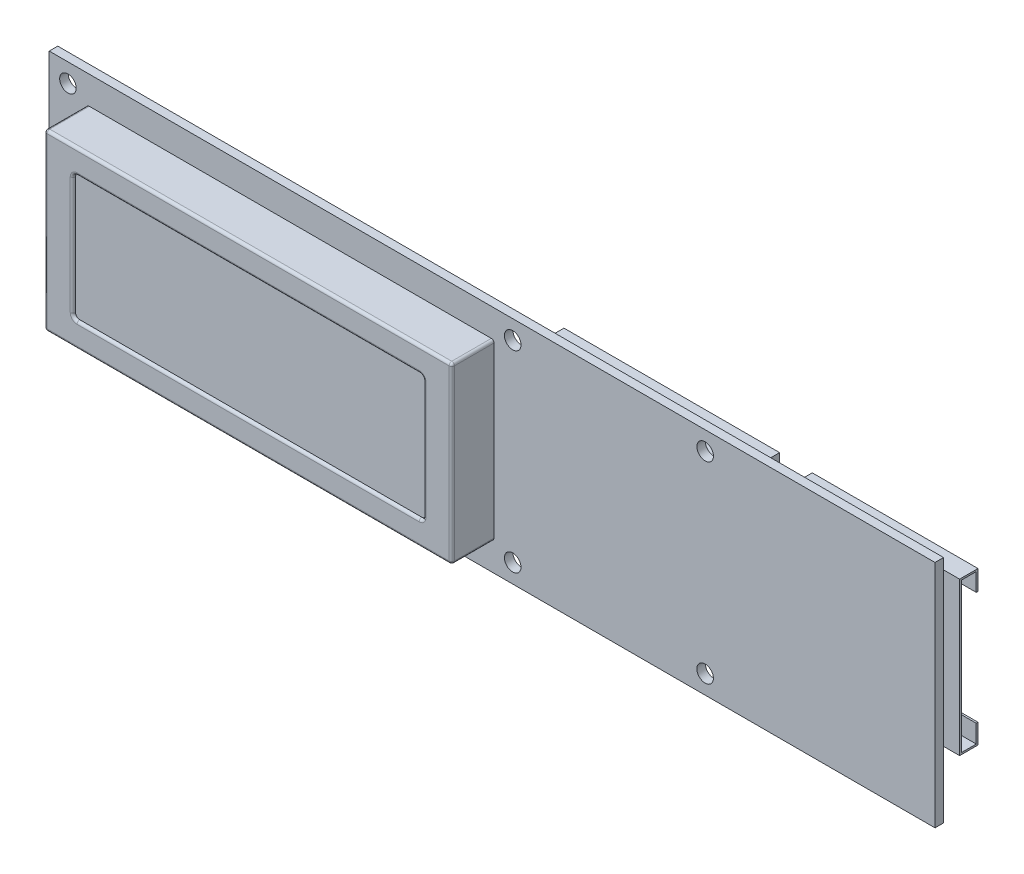
from build123d import *

# Parameters (mm, degrees)
SKETCH1_R                  = 1.55
BOSS_EXTRUDE1_DEPTH        = 1.6
SKETCH3_W                  = 76.2
SKETCH3_H                  = 32.6
BOSS_EXTRUDE3_DEPTH        = 7.9
CUT_EXTRUDE1_DEPTH         = 0.5
FILLET1_R                  = 0.5
SKETCH5_W                  = 31
SKETCH5_H                  = 28.6
BOSS_EXTRUDE4_DEPTH        = 3.44
SKETCH6_W                  = 2.78
SKETCH6_H                  = 27.94
CUT_EXTRUDE2_DEPTH         = 30.5
CUT_EXTRUDE3_DEPTH         = 0.33
SKETCH8_W                  = 40.34
SKETCH8_H                  = 9
BOSS_EXTRUDE5_DEPTH        = 10.16
CUT_EXTRUDE4_DEPTH         = 7.34
SKETCH10_W                 = 0.65
SKETCH10_H                 = 0.65
BOSS_EXTRUDE6_DEPTH        = 7.34
LPATTERN2_COUNT            = 8
LPATTERN2_PITCH            = 2.54
LPATTERN2_COL_COUNT        = 6
LPATTERN2_COL_PITCH        = 2.54
LPATTERN3_COUNT            = 2
LPATTERN3_PITCH            = 2.54
LPATTERN3_COPY_1_SKETCH_W  = 0.65
LPATTERN3_COPY_1_SKETCH_H  = 0.65
LPATTERN3_COPY_1_DEPTH     = 7.34
LPATTERN3_COPY_2_SKETCH_W  = 0.65
LPATTERN3_COPY_2_SKETCH_H  = 0.65
LPATTERN3_COPY_2_DEPTH     = 7.34
LPATTERN3_COPY_3_SKETCH_W  = 0.65
LPATTERN3_COPY_3_SKETCH_H  = 0.65
LPATTERN3_COPY_3_DEPTH     = 7.34
LPATTERN3_COPY_4_SKETCH_W  = 0.65
LPATTERN3_COPY_4_SKETCH_H  = 0.65
LPATTERN3_COPY_4_DEPTH     = 7.34
LPATTERN3_COPY_5_SKETCH_W  = 0.65
LPATTERN3_COPY_5_SKETCH_H  = 0.65
LPATTERN3_COPY_5_DEPTH     = 7.34
LPATTERN3_COPY_6_SKETCH_W  = 0.65
LPATTERN3_COPY_6_SKETCH_H  = 0.65
LPATTERN3_COPY_6_DEPTH     = 7.34
LPATTERN3_COPY_7_SKETCH_W  = 0.65
LPATTERN3_COPY_7_SKETCH_H  = 0.65
LPATTERN3_COPY_7_DEPTH     = 7.34
LPATTERN3_COPY_8_SKETCH_W  = 0.65
LPATTERN3_COPY_8_SKETCH_H  = 0.65
LPATTERN3_COPY_8_DEPTH     = 7.34
LPATTERN3_COPY_9_SKETCH_W  = 0.65
LPATTERN3_COPY_9_SKETCH_H  = 0.65
LPATTERN3_COPY_9_DEPTH     = 7.34
LPATTERN3_COPY_10_SKETCH_W = 0.65
LPATTERN3_COPY_10_SKETCH_H = 0.65
LPATTERN3_COPY_10_DEPTH    = 7.34
LPATTERN3_COPY_11_SKETCH_W = 0.65
LPATTERN3_COPY_11_SKETCH_H = 0.65
LPATTERN3_COPY_11_DEPTH    = 7.34
LPATTERN3_COPY_12_SKETCH_W = 0.65
LPATTERN3_COPY_12_SKETCH_H = 0.65
LPATTERN3_COPY_12_DEPTH    = 7.34
CHAMFER1_SIZE              = 0.25
SKETCH14_W                 = 0.65
SKETCH14_H                 = 5.025
BOSS_EXTRUDE8_DEPTH        = 0.62


with BuildPart() as part:
    # Sketch1 → Boss-Extrude1 (new body)
    with BuildSketch(Plane.XY):
        Polygon((0, 43), (126.2, 43), (165.7, 43), (165.7, 0), (126.2, 0), (0, 0), align=None)
        with Locations((3.5, 39.5)):
            Circle(SKETCH1_R, mode=Mode.SUBTRACT)
        with Locations((122.7, 39.5)):
            Circle(SKETCH1_R, mode=Mode.SUBTRACT)
        with Locations((122.7, 3.5)):
            Circle(SKETCH1_R, mode=Mode.SUBTRACT)
        with Locations((3.5, 3.5)):
            Circle(SKETCH1_R, mode=Mode.SUBTRACT)
        with Locations((86.7, 39.5)):
            Circle(SKETCH1_R, mode=Mode.SUBTRACT)
        with Locations((86.7, 3.5)):
            Circle(SKETCH1_R, mode=Mode.SUBTRACT)
    extrude(amount=BOSS_EXTRUDE1_DEPTH)

    # Sketch3 → Boss-Extrude3 (add)
    with BuildSketch(Plane.XY.offset(1.6)):
        with Locations((45.1, 21.5)):
            Rectangle(SKETCH3_W, SKETCH3_H)
    extrude(amount=BOSS_EXTRUDE3_DEPTH)

    # Sketch4 → Cut-Extrude1 (cut)
    with BuildSketch(Plane.XY.offset(9.5)):
        with BuildLine():
            Line((13.1, 33.271220178), (77.1, 33.271220178))
            ThreePointArc((77.1, 33.271220178), (77.645335018, 33.045335018), (77.871220178, 32.5))
            Line((77.871220178, 32.5), (77.871220178, 10.5))
            ThreePointArc((77.871220178, 10.5), (77.645335018, 9.954664982), (77.1, 9.728779822))
            Line((77.1, 9.728779822), (13.1, 9.728779822))
            ThreePointArc((13.1, 9.728779822), (12.554664982, 9.954664982), (12.328779822, 10.5))
            Line((12.328779822, 10.5), (12.328779822, 32.5))
            ThreePointArc((12.328779822, 32.5), (12.554664982, 33.045335018), (13.1, 33.271220178))
        make_face()
    extrude(amount=-CUT_EXTRUDE1_DEPTH, mode=Mode.SUBTRACT)

    # Fillet1
    fillet1_edges = [part.edges().sort_by_distance(p)[0] for p in [
        (45.1, 37.8, 9.5),
        (83.2, 21.5, 9.5),
        (45.1, 5.2, 9.5),
        (7, 21.5, 9.5),
        (45.1, 33.271220178, 9.5),
        (12.554664982, 33.045335018, 9.5),
        (12.328779822, 21.5, 9.5),
        (12.554664982, 9.954664982, 9.5),
        (45.1, 9.728779822, 9.5),
        (77.645335018, 9.954664982, 9.5),
        (77.871220178, 21.5, 9.5),
        (77.645335018, 33.045335018, 9.5),
        (7, 5.2, 5.55),
        (83.2, 5.2, 5.55),
        (83.2, 37.8, 5.55),
        (7, 37.8, 5.55),
    ]]
    fillet(fillet1_edges, radius=FILLET1_R - 0.0001)  # a hair under: the kernel refuses the full size

    # Sketch5 → Boss-Extrude4 (add)
    with BuildSketch(Plane(origin=(0, 0, 0), x_dir=(-1, 0, 0), z_dir=(0, 0, -1))):
        with Locations((-153.2, 26.7)):
            Rectangle(SKETCH5_W, SKETCH5_H)
    extrude(amount=BOSS_EXTRUDE4_DEPTH)

    # Sketch6 → Cut-Extrude2 (cut)
    with BuildSketch(Plane(origin=(168.7, 0, 0), x_dir=(0, 0, -1), z_dir=(1, 0, 0))):
        with Locations((1.72, 26.7)):
            Rectangle(SKETCH6_W, SKETCH6_H)
    extrude(amount=-CUT_EXTRUDE2_DEPTH, mode=Mode.SUBTRACT)

    # Sketch7 → Cut-Extrude3 (cut)
    with BuildSketch(Plane(origin=(0, 0, -3.44), x_dir=(-1, 0, 0), z_dir=(0, 0, -1))):
        with BuildLine():
            Line((-168.7, 37.3), (-153.685513052, 37.3))
            ThreePointArc((-153.685513052, 37.3), (-151, 26.7), (-153.685513052, 16.1))
            Line((-153.685513052, 16.1), (-168.7, 16.1))
            Line((-168.7, 16.1), (-168.7, 37.3))
        make_face()
    extrude(amount=-CUT_EXTRUDE3_DEPTH, mode=Mode.SUBTRACT)

    # Sketch8 → Boss-Extrude5 (add)
    with BuildSketch(Plane(origin=(0, 0, 0), x_dir=(-1, 0, 0), z_dir=(0, 0, -1))):
        with Locations((-104.7, 30)):
            Rectangle(SKETCH8_W, SKETCH8_H)
    extrude(amount=BOSS_EXTRUDE5_DEPTH)

    # Sketch9 → Cut-Extrude4 (cut)
    with BuildSketch(Plane(origin=(0, 0, -10.16), x_dir=(-1, 0, 0), z_dir=(0, 0, -1))):
        Polygon((-106.95, 26.5), (-106.95, 25.5), (-102.45, 25.5), (-102.45, 26.5), (-85.53, 26.5), (-85.53, 33.5), (-123.87, 33.5), (-123.87, 26.5), align=None)
    extrude(amount=-CUT_EXTRUDE4_DEPTH, mode=Mode.SUBTRACT)

    # Sketch10 → Boss-Extrude6 (add)
    with BuildSketch(Plane(origin=(0, 0, -2.82), x_dir=(-1, 0, 0), z_dir=(0, 0, -1))):
        with Locations((-107.24, 31.27)):
            Rectangle(SKETCH10_W, SKETCH10_H)
    boss_extrude6 = extrude(amount=BOSS_EXTRUDE6_DEPTH)

    # LPattern2: Boss-Extrude6 ×8
    with Locations(*[(-i * LPATTERN2_PITCH, 0, 0) for i in range(1, LPATTERN2_COUNT)]):
        add(boss_extrude6)

    # LPattern2 col: Boss-Extrude6 ×6
    with Locations(*[(i * LPATTERN2_COL_PITCH, 0, 0) for i in range(1, LPATTERN2_COL_COUNT)]):
        add(boss_extrude6)

    # LPattern3: Boss-Extrude6 ×2
    with Locations(*[(0, -i * LPATTERN3_PITCH, 0) for i in range(1, LPATTERN3_COUNT)]):
        add(boss_extrude6)

    # LPattern3 copy 1 sketch → LPattern3 copy 1 (add)
    with BuildSketch(Plane(origin=(-2.54, -2.54, -2.82), x_dir=(-1, 0, 0), z_dir=(0, 0, -1))):
        with Locations((-107.24, 31.27)):
            Rectangle(LPATTERN3_COPY_1_SKETCH_W, LPATTERN3_COPY_1_SKETCH_H)
    extrude(amount=LPATTERN3_COPY_1_DEPTH)

    # LPattern3 copy 2 sketch → LPattern3 copy 2 (add)
    with BuildSketch(Plane(origin=(-5.08, -2.54, -2.82), x_dir=(-1, 0, 0), z_dir=(0, 0, -1))):
        with Locations((-107.24, 31.27)):
            Rectangle(LPATTERN3_COPY_2_SKETCH_W, LPATTERN3_COPY_2_SKETCH_H)
    extrude(amount=LPATTERN3_COPY_2_DEPTH)

    # LPattern3 copy 3 sketch → LPattern3 copy 3 (add)
    with BuildSketch(Plane(origin=(-7.62, -2.54, -2.82), x_dir=(-1, 0, 0), z_dir=(0, 0, -1))):
        with Locations((-107.24, 31.27)):
            Rectangle(LPATTERN3_COPY_3_SKETCH_W, LPATTERN3_COPY_3_SKETCH_H)
    extrude(amount=LPATTERN3_COPY_3_DEPTH)

    # LPattern3 copy 4 sketch → LPattern3 copy 4 (add)
    with BuildSketch(Plane(origin=(-10.16, -2.54, -2.82), x_dir=(-1, 0, 0), z_dir=(0, 0, -1))):
        with Locations((-107.24, 31.27)):
            Rectangle(LPATTERN3_COPY_4_SKETCH_W, LPATTERN3_COPY_4_SKETCH_H)
    extrude(amount=LPATTERN3_COPY_4_DEPTH)

    # LPattern3 copy 5 sketch → LPattern3 copy 5 (add)
    with BuildSketch(Plane(origin=(-12.7, -2.54, -2.82), x_dir=(-1, 0, 0), z_dir=(0, 0, -1))):
        with Locations((-107.24, 31.27)):
            Rectangle(LPATTERN3_COPY_5_SKETCH_W, LPATTERN3_COPY_5_SKETCH_H)
    extrude(amount=LPATTERN3_COPY_5_DEPTH)

    # LPattern3 copy 6 sketch → LPattern3 copy 6 (add)
    with BuildSketch(Plane(origin=(-15.24, -2.54, -2.82), x_dir=(-1, 0, 0), z_dir=(0, 0, -1))):
        with Locations((-107.24, 31.27)):
            Rectangle(LPATTERN3_COPY_6_SKETCH_W, LPATTERN3_COPY_6_SKETCH_H)
    extrude(amount=LPATTERN3_COPY_6_DEPTH)

    # LPattern3 copy 7 sketch → LPattern3 copy 7 (add)
    with BuildSketch(Plane(origin=(-17.78, -2.54, -2.82), x_dir=(-1, 0, 0), z_dir=(0, 0, -1))):
        with Locations((-107.24, 31.27)):
            Rectangle(LPATTERN3_COPY_7_SKETCH_W, LPATTERN3_COPY_7_SKETCH_H)
    extrude(amount=LPATTERN3_COPY_7_DEPTH)

    # LPattern3 copy 8 sketch → LPattern3 copy 8 (add)
    with BuildSketch(Plane(origin=(2.54, -2.54, -2.82), x_dir=(-1, 0, 0), z_dir=(0, 0, -1))):
        with Locations((-107.24, 31.27)):
            Rectangle(LPATTERN3_COPY_8_SKETCH_W, LPATTERN3_COPY_8_SKETCH_H)
    extrude(amount=LPATTERN3_COPY_8_DEPTH)

    # LPattern3 copy 9 sketch → LPattern3 copy 9 (add)
    with BuildSketch(Plane(origin=(5.08, -2.54, -2.82), x_dir=(-1, 0, 0), z_dir=(0, 0, -1))):
        with Locations((-107.24, 31.27)):
            Rectangle(LPATTERN3_COPY_9_SKETCH_W, LPATTERN3_COPY_9_SKETCH_H)
    extrude(amount=LPATTERN3_COPY_9_DEPTH)

    # LPattern3 copy 10 sketch → LPattern3 copy 10 (add)
    with BuildSketch(Plane(origin=(7.62, -2.54, -2.82), x_dir=(-1, 0, 0), z_dir=(0, 0, -1))):
        with Locations((-107.24, 31.27)):
            Rectangle(LPATTERN3_COPY_10_SKETCH_W, LPATTERN3_COPY_10_SKETCH_H)
    extrude(amount=LPATTERN3_COPY_10_DEPTH)

    # LPattern3 copy 11 sketch → LPattern3 copy 11 (add)
    with BuildSketch(Plane(origin=(10.16, -2.54, -2.82), x_dir=(-1, 0, 0), z_dir=(0, 0, -1))):
        with Locations((-107.24, 31.27)):
            Rectangle(LPATTERN3_COPY_11_SKETCH_W, LPATTERN3_COPY_11_SKETCH_H)
    extrude(amount=LPATTERN3_COPY_11_DEPTH)

    # LPattern3 copy 12 sketch → LPattern3 copy 12 (add)
    with BuildSketch(Plane(origin=(12.7, -2.54, -2.82), x_dir=(-1, 0, 0), z_dir=(0, 0, -1))):
        with Locations((-107.24, 31.27)):
            Rectangle(LPATTERN3_COPY_12_SKETCH_W, LPATTERN3_COPY_12_SKETCH_H)
    extrude(amount=LPATTERN3_COPY_12_DEPTH)

    # Chamfer1
    chamfer1_edges = [part.edges().sort_by_distance(p)[0] for p in [
        (107.24, 31.595, -10.16),
        (106.915, 31.27, -10.16),
        (107.24, 30.945, -10.16),
        (107.565, 31.27, -10.16),
        (109.78, 31.595, -10.16),
        (109.455, 31.27, -10.16),
        (109.78, 30.945, -10.16),
        (110.105, 31.27, -10.16),
        (112.32, 31.595, -10.16),
        (111.995, 31.27, -10.16),
        (112.32, 30.945, -10.16),
        (112.645, 31.27, -10.16),
        (114.86, 31.595, -10.16),
        (114.535, 31.27, -10.16),
        (114.86, 30.945, -10.16),
        (115.185, 31.27, -10.16),
        (117.4, 31.595, -10.16),
        (117.075, 31.27, -10.16),
        (117.4, 30.945, -10.16),
        (117.725, 31.27, -10.16),
        (119.94, 31.595, -10.16),
        (119.615, 31.27, -10.16),
        (119.94, 30.945, -10.16),
        (120.265, 31.27, -10.16),
        (104.7, 31.595, -10.16),
        (104.375, 31.27, -10.16),
        (104.7, 30.945, -10.16),
        (105.025, 31.27, -10.16),
        (102.16, 31.595, -10.16),
        (101.835, 31.27, -10.16),
        (102.16, 30.945, -10.16),
        (102.485, 31.27, -10.16),
        (99.62, 31.595, -10.16),
        (99.295, 31.27, -10.16),
        (99.62, 30.945, -10.16),
        (99.945, 31.27, -10.16),
        (97.08, 31.595, -10.16),
        (96.755, 31.27, -10.16),
        (97.08, 30.945, -10.16),
        (97.405, 31.27, -10.16),
        (94.54, 31.595, -10.16),
        (94.215, 31.27, -10.16),
        (94.54, 30.945, -10.16),
        (94.865, 31.27, -10.16),
        (92, 31.595, -10.16),
        (91.675, 31.27, -10.16),
        (92, 30.945, -10.16),
        (92.325, 31.27, -10.16),
        (89.46, 31.595, -10.16),
        (89.135, 31.27, -10.16),
        (89.46, 30.945, -10.16),
        (89.785, 31.27, -10.16),
        (107.24, 29.055, -10.16),
        (106.915, 28.73, -10.16),
        (107.24, 28.405, -10.16),
        (107.565, 28.73, -10.16),
        (109.78, 29.055, -10.16),
        (109.455, 28.73, -10.16),
        (109.78, 28.405, -10.16),
        (110.105, 28.73, -10.16),
        (112.32, 29.055, -10.16),
        (111.995, 28.73, -10.16),
        (112.32, 28.405, -10.16),
        (112.645, 28.73, -10.16),
        (114.86, 29.055, -10.16),
        (114.535, 28.73, -10.16),
        (114.86, 28.405, -10.16),
        (115.185, 28.73, -10.16),
        (117.4, 29.055, -10.16),
        (117.075, 28.73, -10.16),
        (117.4, 28.405, -10.16),
        (117.725, 28.73, -10.16),
        (119.94, 29.055, -10.16),
        (119.615, 28.73, -10.16),
        (119.94, 28.405, -10.16),
        (120.265, 28.73, -10.16),
        (104.7, 29.055, -10.16),
        (104.375, 28.73, -10.16),
        (104.7, 28.405, -10.16),
        (105.025, 28.73, -10.16),
        (102.16, 29.055, -10.16),
        (101.835, 28.73, -10.16),
        (102.16, 28.405, -10.16),
        (102.485, 28.73, -10.16),
        (99.62, 29.055, -10.16),
        (99.295, 28.73, -10.16),
        (99.62, 28.405, -10.16),
        (99.945, 28.73, -10.16),
        (97.08, 29.055, -10.16),
        (96.755, 28.73, -10.16),
        (97.08, 28.405, -10.16),
        (97.405, 28.73, -10.16),
        (94.54, 29.055, -10.16),
        (94.215, 28.73, -10.16),
        (94.54, 28.405, -10.16),
        (94.865, 28.73, -10.16),
        (92, 29.055, -10.16),
        (91.675, 28.73, -10.16),
        (92, 28.405, -10.16),
        (92.325, 28.73, -10.16),
        (89.46, 29.055, -10.16),
        (89.135, 28.73, -10.16),
        (89.46, 28.405, -10.16),
        (89.785, 28.73, -10.16),
    ]]
    chamfer(chamfer1_edges, length=CHAMFER1_SIZE)

    # Sketch14 → Boss-Extrude8 (add)
    with BuildSketch(Plane(origin=(0, 0, 0), x_dir=(-1, 0, 0), z_dir=(0, 0, -1))):
        with Locations((-119.94, 33.4575)):
            Rectangle(SKETCH14_W, SKETCH14_H)
        with Locations((-117.4, 33.4575)):
            Rectangle(SKETCH14_W, SKETCH14_H)
        with Locations((-114.86, 33.4575)):
            Rectangle(SKETCH14_W, SKETCH14_H)
        with Locations((-112.32, 33.4575)):
            Rectangle(SKETCH14_W, SKETCH14_H)
        with Locations((-109.78, 33.4575)):
            Rectangle(SKETCH14_W, SKETCH14_H)
        with Locations((-107.24, 33.4575)):
            Rectangle(SKETCH14_W, SKETCH14_H)
        with Locations((-104.7, 33.4575)):
            Rectangle(SKETCH14_W, SKETCH14_H)
        with Locations((-102.16, 33.4575)):
            Rectangle(SKETCH14_W, SKETCH14_H)
        with Locations((-99.62, 33.4575)):
            Rectangle(SKETCH14_W, SKETCH14_H)
        with Locations((-97.08, 33.4575)):
            Rectangle(SKETCH14_W, SKETCH14_H)
        with Locations((-94.54, 33.4575)):
            Rectangle(SKETCH14_W, SKETCH14_H)
        with Locations((-92, 33.4575)):
            Rectangle(SKETCH14_W, SKETCH14_H)
        with Locations((-89.46, 33.4575)):
            Rectangle(SKETCH14_W, SKETCH14_H)
        with Locations((-114.86, 26.5425)):
            Rectangle(SKETCH14_W, SKETCH14_H)
        with Locations((-112.32, 26.5425)):
            Rectangle(SKETCH14_W, SKETCH14_H)
        with Locations((-109.78, 26.5425)):
            Rectangle(SKETCH14_W, SKETCH14_H)
        with Locations((-107.24, 26.5425)):
            Rectangle(SKETCH14_W, SKETCH14_H)
        with Locations((-104.7, 26.5425)):
            Rectangle(SKETCH14_W, SKETCH14_H)
        with Locations((-102.16, 26.5425)):
            Rectangle(SKETCH14_W, SKETCH14_H)
        with Locations((-99.62, 26.5425)):
            Rectangle(SKETCH14_W, SKETCH14_H)
        with Locations((-97.08, 26.5425)):
            Rectangle(SKETCH14_W, SKETCH14_H)
        with Locations((-94.54, 26.5425)):
            Rectangle(SKETCH14_W, SKETCH14_H)
        with Locations((-92, 26.5425)):
            Rectangle(SKETCH14_W, SKETCH14_H)
        with Locations((-89.46, 26.5425)):
            Rectangle(SKETCH14_W, SKETCH14_H)
        with Locations((-119.94, 26.5425)):
            Rectangle(SKETCH14_W, SKETCH14_H)
        with Locations((-117.4, 26.5425)):
            Rectangle(SKETCH14_W, SKETCH14_H)
    extrude(amount=BOSS_EXTRUDE8_DEPTH)


solid = part.part
